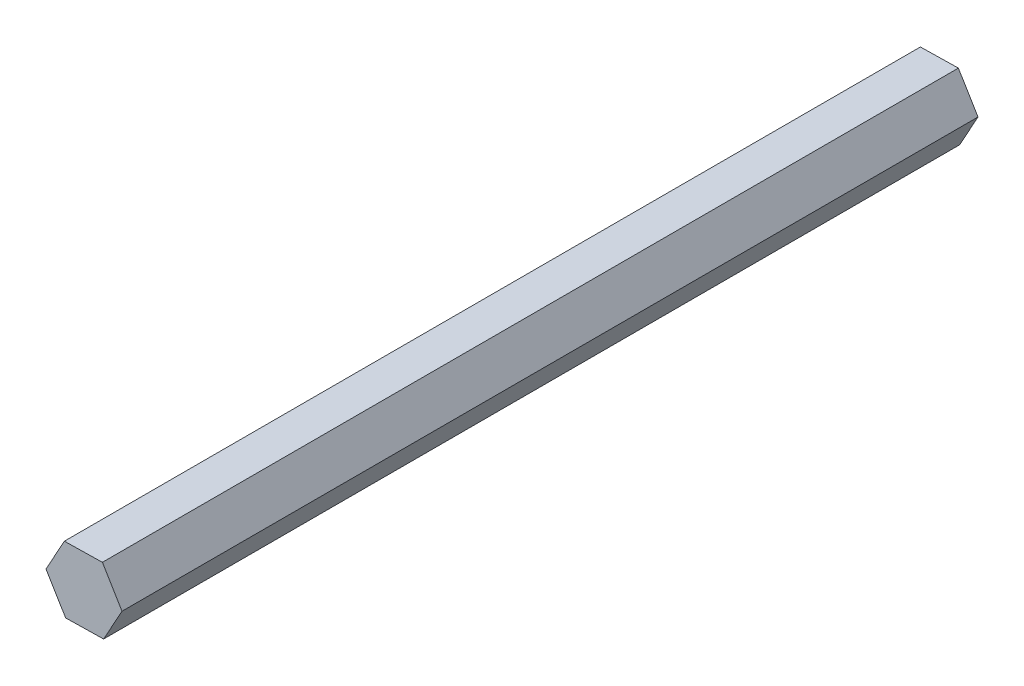
from build123d import *

# Parameters (mm, degrees)
BOSS_EXTRUDE1_DEPTH = 165.1


with BuildPart() as part:
    # Sketch1 → Boss-Extrude1 (new body)
    with BuildSketch(Plane.XY):
        Polygon((3.784554112, -6.280165882), (7.33106025, 0.137437062), (3.546506138, 6.417602944), (-3.784554112, 6.280165882), (-7.33106025, -0.137437062), (-3.546506138, -6.417602944), align=None)
    extrude(amount=BOSS_EXTRUDE1_DEPTH)


solid = part.part
